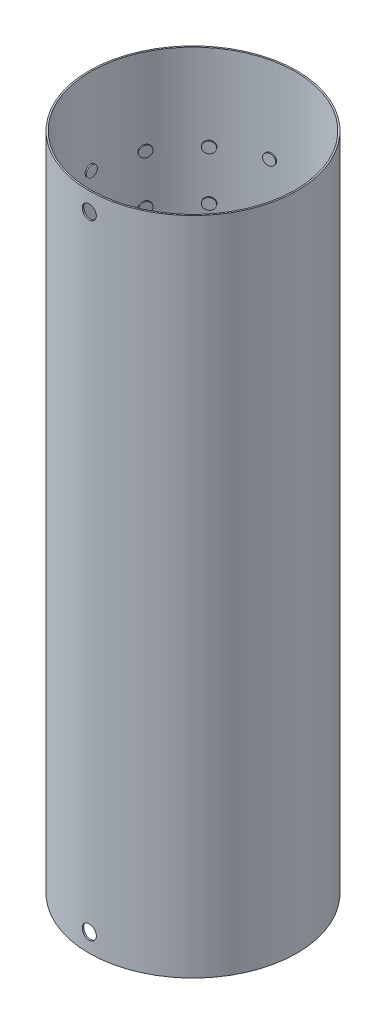
from build123d import *

# Parameters (mm, degrees)
SKETCH1_R                = 42.5
SKETCH1_R_2              = 41.9
BOSS_EXTRUDE1_DEPTH      = 270
BOSS_EXTRUDE2_REACH      = 278.609
BOSS_EXTRUDE2_END_RADIUS = 41.9
SKETCH2_R                = 2.25
CIRPATTERN2_COUNT        = 14
SKETCH4_R                = 41.4
CUT_EXTRUDE2_DEPTH       = 277.608929816
SKETCH6_R                = 2.875
CUT_EXTRUDE3_DEPTH       = 277.608929816


with BuildPart() as part:
    # Sketch1 → Boss-Extrude1 (new body)
    with BuildSketch(Plane(origin=(0, 0, 0), x_dir=(1, 0, 0), z_dir=(0, 1, 0))):
        with Locations(Location((0, 0, 0), (0, 0, 270))):
            Circle(SKETCH1_R)
        with Locations(Location((0, 0, 0), (0, 0, 270))):
            Circle(SKETCH1_R_2, mode=Mode.SUBTRACT)
    extrude(amount=BOSS_EXTRUDE1_DEPTH)

    # Boss-Extrude2: up to this cylinder (the profile starts inside it)
    boss_extrude2_end = Plane(origin=(0, 135, 0), z_dir=(0, -1, 0)) * Cylinder(BOSS_EXTRUDE2_END_RADIUS, 842.018, mode=Mode.PRIVATE)
    # Sketch2 → Boss-Extrude2 (add, up to the surface)
    with BuildSketch(Plane(origin=(0, 0, 0), x_dir=(0, 0, -1), z_dir=(1, 0, 0)), mode=Mode.PRIVATE) as boss_extrude2_sk1:
        with Locations(Location((0, 135, 0), (0, 0, 180))):
            Circle(SKETCH2_R)
    boss_extrude2_tool1 = extrude(boss_extrude2_sk1.sketch, amount=BOSS_EXTRUDE2_REACH, mode=Mode.PRIVATE) & boss_extrude2_end
    # Sketch2 → Boss-Extrude2 (add, up to the surface)
    with BuildSketch(Plane(origin=(0, 0, 0), x_dir=(0, 0, -1), z_dir=(1, 0, 0)), mode=Mode.PRIVATE) as boss_extrude2_sk2:
        with Locations(Location((0, 155, 0), (0, 0, 180))):
            Circle(SKETCH2_R)
    boss_extrude2_tool2 = extrude(boss_extrude2_sk2.sketch, amount=BOSS_EXTRUDE2_REACH, mode=Mode.PRIVATE) & boss_extrude2_end
    # Sketch2 → Boss-Extrude2 (add, up to the surface)
    with BuildSketch(Plane(origin=(0, 0, 0), x_dir=(0, 0, -1), z_dir=(1, 0, 0)), mode=Mode.PRIVATE) as boss_extrude2_sk3:
        with Locations(Location((0, 175, 0), (0, 0, 180))):
            Circle(SKETCH2_R)
    boss_extrude2_tool3 = extrude(boss_extrude2_sk3.sketch, amount=BOSS_EXTRUDE2_REACH, mode=Mode.PRIVATE) & boss_extrude2_end
    # Sketch2 → Boss-Extrude2 (add, up to the surface)
    with BuildSketch(Plane(origin=(0, 0, 0), x_dir=(0, 0, -1), z_dir=(1, 0, 0)), mode=Mode.PRIVATE) as boss_extrude2_sk4:
        with Locations(Location((0, 195, 0), (0, 0, 180))):
            Circle(SKETCH2_R)
    boss_extrude2_tool4 = extrude(boss_extrude2_sk4.sketch, amount=BOSS_EXTRUDE2_REACH, mode=Mode.PRIVATE) & boss_extrude2_end
    # Sketch2 → Boss-Extrude2 (add, up to the surface)
    with BuildSketch(Plane(origin=(0, 0, 0), x_dir=(0, 0, -1), z_dir=(1, 0, 0)), mode=Mode.PRIVATE) as boss_extrude2_sk5:
        with Locations(Location((0, 215, 0), (0, 0, 180))):
            Circle(SKETCH2_R)
    boss_extrude2_tool5 = extrude(boss_extrude2_sk5.sketch, amount=BOSS_EXTRUDE2_REACH, mode=Mode.PRIVATE) & boss_extrude2_end
    # Sketch2 → Boss-Extrude2 (add, up to the surface)
    with BuildSketch(Plane(origin=(0, 0, 0), x_dir=(0, 0, -1), z_dir=(1, 0, 0)), mode=Mode.PRIVATE) as boss_extrude2_sk6:
        with Locations(Location((0, 235, 0), (0, 0, 180))):
            Circle(SKETCH2_R)
    boss_extrude2_tool6 = extrude(boss_extrude2_sk6.sketch, amount=BOSS_EXTRUDE2_REACH, mode=Mode.PRIVATE) & boss_extrude2_end
    # Sketch2 → Boss-Extrude2 (add, up to the surface)
    with BuildSketch(Plane(origin=(0, 0, 0), x_dir=(0, 0, -1), z_dir=(1, 0, 0)), mode=Mode.PRIVATE) as boss_extrude2_sk7:
        with Locations(Location((0, 115, 0), (0, 0, 180))):
            Circle(SKETCH2_R)
    boss_extrude2_tool7 = extrude(boss_extrude2_sk7.sketch, amount=BOSS_EXTRUDE2_REACH, mode=Mode.PRIVATE) & boss_extrude2_end
    # Sketch2 → Boss-Extrude2 (add, up to the surface)
    with BuildSketch(Plane(origin=(0, 0, 0), x_dir=(0, 0, -1), z_dir=(1, 0, 0)), mode=Mode.PRIVATE) as boss_extrude2_sk8:
        with Locations(Location((0, 95, 0), (0, 0, 180))):
            Circle(SKETCH2_R)
    boss_extrude2_tool8 = extrude(boss_extrude2_sk8.sketch, amount=BOSS_EXTRUDE2_REACH, mode=Mode.PRIVATE) & boss_extrude2_end
    # Sketch2 → Boss-Extrude2 (add, up to the surface)
    with BuildSketch(Plane(origin=(0, 0, 0), x_dir=(0, 0, -1), z_dir=(1, 0, 0)), mode=Mode.PRIVATE) as boss_extrude2_sk9:
        with Locations(Location((0, 75, 0), (0, 0, 180))):
            Circle(SKETCH2_R)
    boss_extrude2_tool9 = extrude(boss_extrude2_sk9.sketch, amount=BOSS_EXTRUDE2_REACH, mode=Mode.PRIVATE) & boss_extrude2_end
    # Sketch2 → Boss-Extrude2 (add, up to the surface)
    with BuildSketch(Plane(origin=(0, 0, 0), x_dir=(0, 0, -1), z_dir=(1, 0, 0)), mode=Mode.PRIVATE) as boss_extrude2_sk10:
        with Locations(Location((0, 55, 0), (0, 0, 180))):
            Circle(SKETCH2_R)
    boss_extrude2_tool10 = extrude(boss_extrude2_sk10.sketch, amount=BOSS_EXTRUDE2_REACH, mode=Mode.PRIVATE) & boss_extrude2_end
    # Sketch2 → Boss-Extrude2 (add, up to the surface)
    with BuildSketch(Plane(origin=(0, 0, 0), x_dir=(0, 0, -1), z_dir=(1, 0, 0)), mode=Mode.PRIVATE) as boss_extrude2_sk11:
        with Locations(Location((0, 35, 0), (0, 0, 180))):
            Circle(SKETCH2_R)
    boss_extrude2_tool11 = extrude(boss_extrude2_sk11.sketch, amount=BOSS_EXTRUDE2_REACH, mode=Mode.PRIVATE) & boss_extrude2_end
    boss_extrude2 = boss_extrude2_tool1.solids().sort_by_distance((0, 135, 0))[0] + boss_extrude2_tool2.solids().sort_by_distance((0, 155, 0))[0] + boss_extrude2_tool3.solids().sort_by_distance((0, 175, 0))[0] + boss_extrude2_tool4.solids().sort_by_distance((0, 195, 0))[0] + boss_extrude2_tool5.solids().sort_by_distance((0, 215, 0))[0] + boss_extrude2_tool6.solids().sort_by_distance((0, 235, 0))[0] + boss_extrude2_tool7.solids().sort_by_distance((0, 115, 0))[0] + boss_extrude2_tool8.solids().sort_by_distance((0, 95, 0))[0] + boss_extrude2_tool9.solids().sort_by_distance((0, 75, 0))[0] + boss_extrude2_tool10.solids().sort_by_distance((0, 55, 0))[0] + boss_extrude2_tool11.solids().sort_by_distance((0, 35, 0))[0]
    add(boss_extrude2)

    # CirPattern2: Boss-Extrude2 ×14 about axis
    cirpattern2_axis = Axis((0, 270, 0), (0, 1, 0))
    for i in range(1, CIRPATTERN2_COUNT):
        add(boss_extrude2.rotate(cirpattern2_axis, i * 360 / CIRPATTERN2_COUNT))

    # Sketch4 → Cut-Extrude2 (cut, through all)
    with BuildSketch(Plane(origin=(0, 270, 0), x_dir=(1, 0, 0), z_dir=(0, 1, 0))):
        Circle(SKETCH4_R)
    extrude(amount=-CUT_EXTRUDE2_DEPTH, mode=Mode.SUBTRACT)

    # Sketch6 → Cut-Extrude3 (cut, through all)
    with BuildSketch(Plane.XY):
        with Locations(Location((0, 7.5, 0), (0, 0, 270.000000034))):
            Circle(SKETCH6_R)
        with Locations(Location((0, 262.5, 0), (0, 0, 270.000000034))):
            Circle(SKETCH6_R)
    extrude(amount=CUT_EXTRUDE3_DEPTH, mode=Mode.SUBTRACT)


solid = part.part
